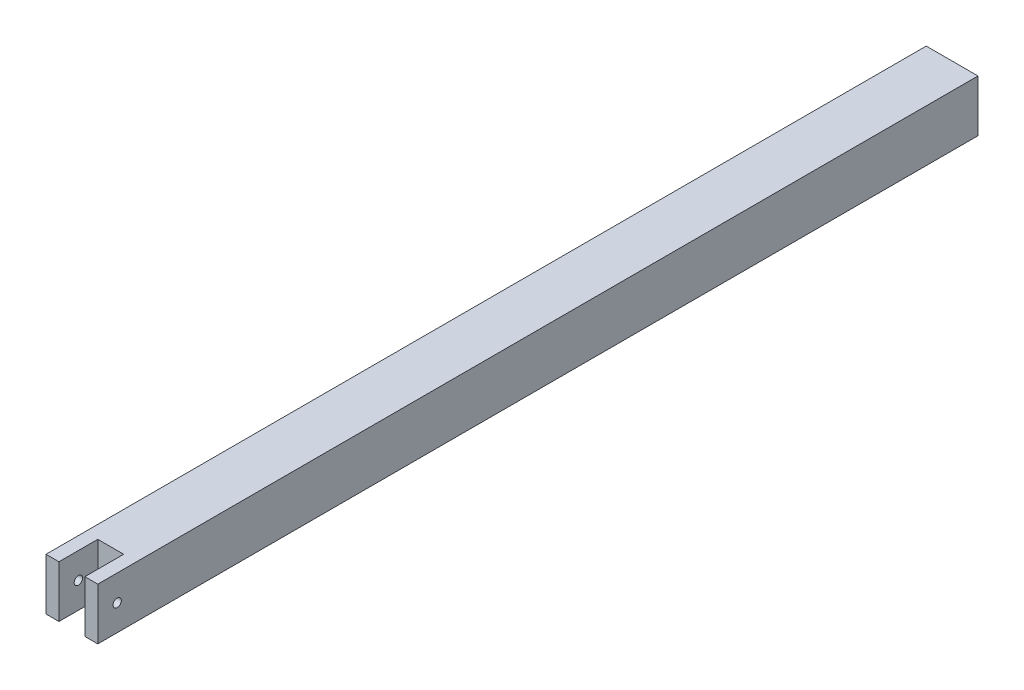
from build123d import *

# Parameters (mm, degrees)
ESQUISSE1_W             = 100
ESQUISSE1_H             = 100
BOSS_EXTRU_1_DEPTH      = 1700
ESQUISSE2_W             = 50
ESQUISSE2_H             = 75
ENL_V_MAT_EXTRU_1_DEPTH = 1706.872210923
ESQUISSE3_R             = 8
ENL_V_MAT_EXTRU_2_DEPTH = 1706.872210923


with BuildPart() as part:
    # Esquisse1 → Boss.-Extru.1 (new body)
    with BuildSketch(Plane.XY):
        with Locations((50, 50)):
            Rectangle(ESQUISSE1_W, ESQUISSE1_H)
    extrude(amount=BOSS_EXTRU_1_DEPTH)

    # Esquisse2 → Enlèv. mat.-Extru.1 (cut, through all)
    with BuildSketch(Plane.XZ):
        with Locations((50, 1662.5)):
            Rectangle(ESQUISSE2_W, ESQUISSE2_H)
    extrude(amount=-ENL_V_MAT_EXTRU_1_DEPTH, mode=Mode.SUBTRACT)

    # Esquisse3 → Enlèv. mat.-Extru.2 (cut, through all)
    with BuildSketch(Plane(origin=(100, 0, 0), x_dir=(0, 0, -1), z_dir=(1, 0, 0))):
        with Locations((-1662.5, 50)):
            Circle(ESQUISSE3_R)
    extrude(amount=-ENL_V_MAT_EXTRU_2_DEPTH, mode=Mode.SUBTRACT)


solid = part.part
